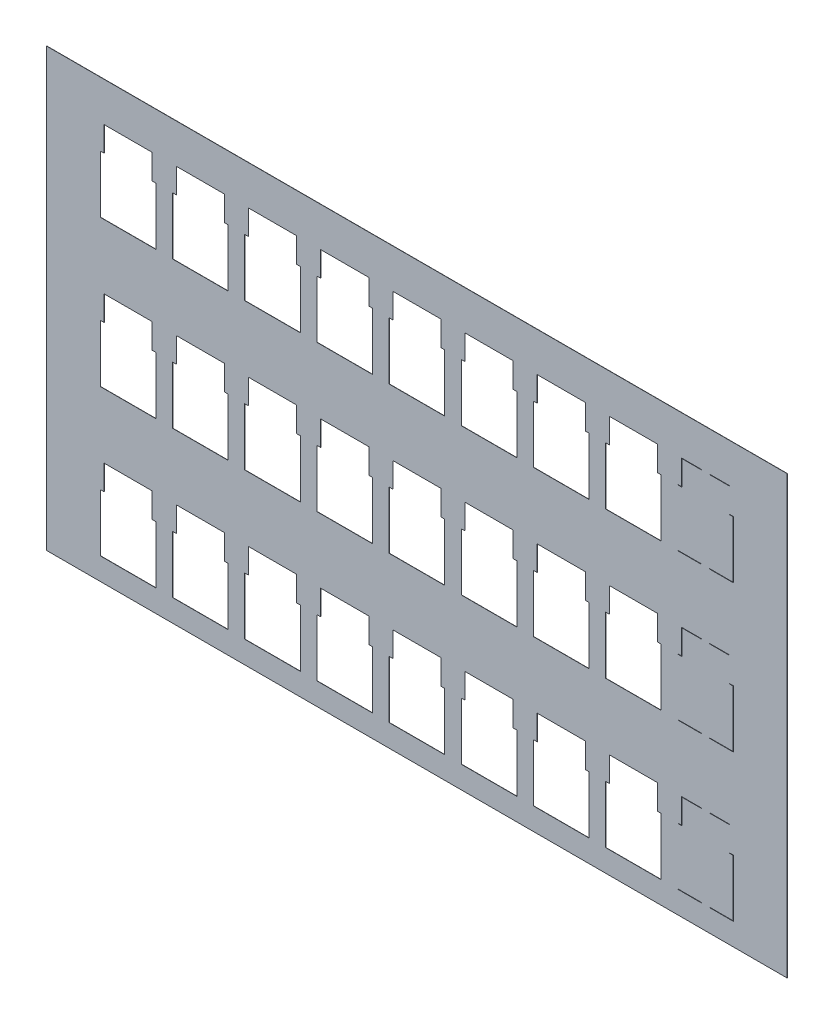
from build123d import *

# Parameters (mm, degrees)
MODEL_W            = 1870
MODEL_H            = 1180
BASE_FLANGE1_DEPTH = 0.6
TAB1_DEPTH         = 0.6
SKETCH4_W          = 65
SKETCH4_H          = 1180
TAB2_DEPTH         = 0.6


# Sheet-metal steps are written as plain solids
with BuildPart() as part:
    # Model → Base-Flange1 (new body)
    with BuildSketch(Plane.XY):
        with Locations((935, 590)):
            Rectangle(MODEL_W, MODEL_H)
        Polygon((1790, 852), (1640, 852), (1640, 1007), (1650, 1007), (1650, 1074), (1780, 1074), (1780, 1007), (1790, 1007), align=None, mode=Mode.SUBTRACT)
        Polygon((1595, 852), (1445, 852), (1445, 1007), (1455, 1007), (1455, 1074), (1585, 1074), (1585, 1007), (1595, 1007), align=None, mode=Mode.SUBTRACT)
        Polygon((1400, 852), (1250, 852), (1250, 1007), (1260, 1007), (1260, 1074), (1390, 1074), (1390, 1007), (1400, 1007), align=None, mode=Mode.SUBTRACT)
        Polygon((1205, 852), (1055, 852), (1055, 1007), (1065, 1007), (1065, 1074), (1195, 1074), (1195, 1007), (1205, 1007), align=None, mode=Mode.SUBTRACT)
        Polygon((1010, 852), (860, 852), (860, 1007), (870, 1007), (870, 1074), (1000, 1074), (1000, 1007), (1010, 1007), align=None, mode=Mode.SUBTRACT)
        Polygon((815, 852), (665, 852), (665, 1007), (675, 1007), (675, 1074), (805, 1074), (805, 1007), (815, 1007), align=None, mode=Mode.SUBTRACT)
        Polygon((620, 852), (470, 852), (470, 1007), (480, 1007), (480, 1074), (610, 1074), (610, 1007), (620, 1007), align=None, mode=Mode.SUBTRACT)
        Polygon((425, 852), (275, 852), (275, 1007), (285, 1007), (285, 1074), (415, 1074), (415, 1007), (425, 1007), align=None, mode=Mode.SUBTRACT)
        Polygon((230, 852), (80, 852), (80, 1007), (90, 1007), (90, 1074), (220, 1074), (220, 1007), (230, 1007), align=None, mode=Mode.SUBTRACT)
        Polygon((1790, 456), (1640, 456), (1640, 611), (1650, 611), (1650, 678), (1780, 678), (1780, 611), (1790, 611), align=None, mode=Mode.SUBTRACT)
        Polygon((1595, 456), (1445, 456), (1445, 611), (1455, 611), (1455, 678), (1585, 678), (1585, 611), (1595, 611), align=None, mode=Mode.SUBTRACT)
        Polygon((1400, 456), (1250, 456), (1250, 611), (1260, 611), (1260, 678), (1390, 678), (1390, 611), (1400, 611), align=None, mode=Mode.SUBTRACT)
        Polygon((1205, 456), (1055, 456), (1055, 611), (1065, 611), (1065, 678), (1195, 678), (1195, 611), (1205, 611), align=None, mode=Mode.SUBTRACT)
        Polygon((1010, 456), (860, 456), (860, 611), (870, 611), (870, 678), (1000, 678), (1000, 611), (1010, 611), align=None, mode=Mode.SUBTRACT)
        Polygon((815, 456), (665, 456), (665, 611), (675, 611), (675, 678), (805, 678), (805, 611), (815, 611), align=None, mode=Mode.SUBTRACT)
        Polygon((620, 456), (470, 456), (470, 611), (480, 611), (480, 678), (610, 678), (610, 611), (620, 611), align=None, mode=Mode.SUBTRACT)
        Polygon((425, 456), (275, 456), (275, 611), (285, 611), (285, 678), (415, 678), (415, 611), (425, 611), align=None, mode=Mode.SUBTRACT)
        Polygon((230, 456), (80, 456), (80, 611), (90, 611), (90, 678), (220, 678), (220, 611), (230, 611), align=None, mode=Mode.SUBTRACT)
        Polygon((1790, 60), (1640, 60), (1640, 215), (1650, 215), (1650, 282), (1780, 282), (1780, 215), (1790, 215), align=None, mode=Mode.SUBTRACT)
        Polygon((1595, 60), (1445, 60), (1445, 215), (1455, 215), (1455, 282), (1585, 282), (1585, 215), (1595, 215), align=None, mode=Mode.SUBTRACT)
        Polygon((1400, 60), (1250, 60), (1250, 215), (1260, 215), (1260, 282), (1390, 282), (1390, 215), (1400, 215), align=None, mode=Mode.SUBTRACT)
        Polygon((1205, 60), (1055, 60), (1055, 215), (1065, 215), (1065, 282), (1195, 282), (1195, 215), (1205, 215), align=None, mode=Mode.SUBTRACT)
        Polygon((1010, 60), (860, 60), (860, 215), (870, 215), (870, 282), (1000, 282), (1000, 215), (1010, 215), align=None, mode=Mode.SUBTRACT)
        Polygon((815, 60), (665, 60), (665, 215), (675, 215), (675, 282), (805, 282), (805, 215), (815, 215), align=None, mode=Mode.SUBTRACT)
        Polygon((620, 60), (470, 60), (470, 215), (480, 215), (480, 282), (610, 282), (610, 215), (620, 215), align=None, mode=Mode.SUBTRACT)
        Polygon((425, 60), (275, 60), (275, 215), (285, 215), (285, 282), (415, 282), (415, 215), (425, 215), align=None, mode=Mode.SUBTRACT)
        Polygon((230, 60), (80, 60), (80, 215), (90, 215), (90, 282), (220, 282), (220, 215), (230, 215), align=None, mode=Mode.SUBTRACT)
    extrude(amount=-BASE_FLANGE1_DEPTH)

    # Sketch1 → Tab1 (add)
    with BuildSketch(Plane.XY):
        Polygon((1651, 1006), (1651, 1073), (1704, 1073), (1704, 1074), (1726, 1074), (1726, 1073), (1779, 1073), (1779, 1006), (1789, 1006), (1789, 853), (1726, 853), (1726, 852), (1704, 852), (1704, 853), (1641, 853), (1641, 1006), align=None)
        Polygon((1651, 610), (1651, 677), (1704, 677), (1704, 678), (1726, 678), (1726, 677), (1779, 677), (1779, 610), (1789, 610), (1789, 457), (1726, 457), (1726, 456), (1704, 456), (1704, 457), (1641, 457), (1641, 610), align=None)
        Polygon((1651, 214), (1651, 281), (1704, 281), (1704, 282), (1726, 282), (1726, 281), (1779, 281), (1779, 214), (1789, 214), (1789, 61), (1726, 61), (1726, 60), (1704, 60), (1704, 61), (1641, 61), (1641, 214), align=None)
    extrude(amount=-TAB1_DEPTH)

    # Sketch4 → Tab2 (add)
    with BuildSketch(Plane.XY):
        with Locations((1902.5, 590)):
            Rectangle(SKETCH4_W, SKETCH4_H)
        with Locations((-32.5, 590)):
            Rectangle(SKETCH4_W, SKETCH4_H)
    extrude(amount=-TAB2_DEPTH)


solid = part.part
